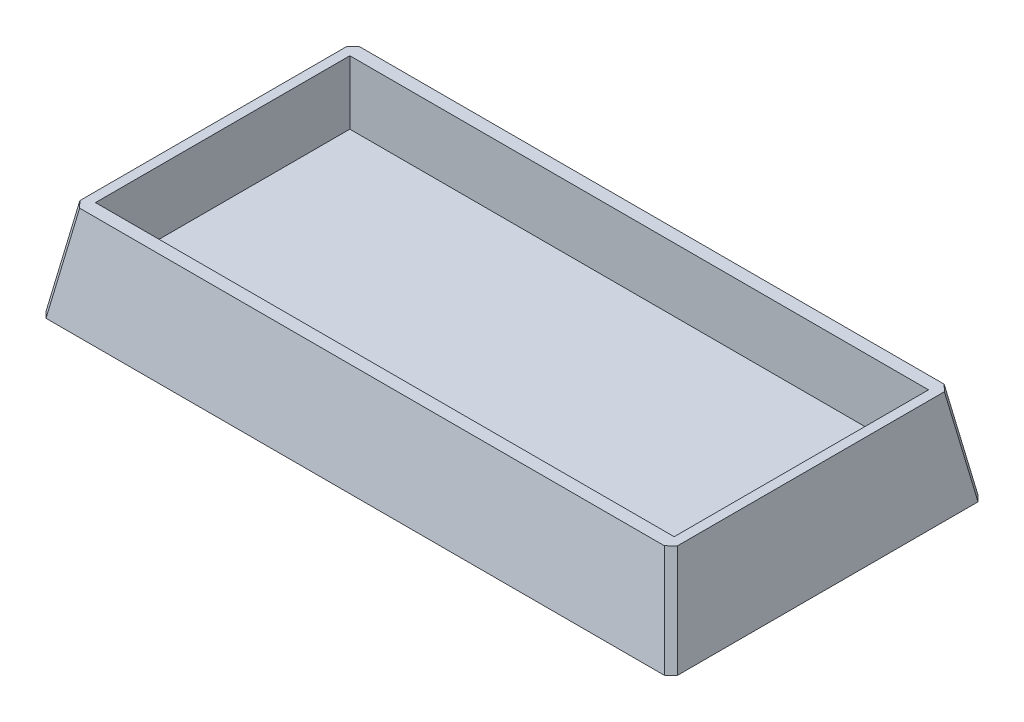
from build123d import *
from OCP.BRepFilletAPI import BRepFilletAPI_MakeChamfer

# Parameters (mm, degrees)
SKETCH2_W           = 100
SKETCH2_H           = 50
SKETCH2_W_2         = 91
SKETCH2_H_2         = 40
BOSS_EXTRUDE1_DEPTH = 10
SKETCH3_W           = 100
SKETCH3_H           = 50
BOSS_EXTRUDE2_DEPTH = 5
CHAMFER1_SIZE       = 17
CHAMFER1_SIZE_2     = 2.997558672
CHAMFER2_SIZE       = 1
CHAMFER2_SIZE2      = 1.031574872


with BuildPart() as part:
    # Sketch2 → Boss-Extrude1 (new body)
    with BuildSketch(Plane(origin=(0, 0, 0), x_dir=(1, 0, 0), z_dir=(0, 1, 0))):
        Rectangle(SKETCH2_W, SKETCH2_H)
        Rectangle(SKETCH2_W_2, SKETCH2_H_2, mode=Mode.SUBTRACT)
    extrude(amount=BOSS_EXTRUDE1_DEPTH)

    # Sketch3 → Boss-Extrude2 (add)
    with BuildSketch(Plane.XZ):
        Rectangle(SKETCH3_W, SKETCH3_H)
    extrude(amount=BOSS_EXTRUDE2_DEPTH)

    # Chamfer1
    # the kernel refuses this chamfer: 17, 2.997558672 mm, written as the material it takes off along each edge
    with BuildSketch(Plane(origin=(-50, 10, 69.175159539), x_dir=(-0.0066825316561016975, -0.9999776716360548, 0), z_dir=(0, 0, -1)), Plane(origin=(50, 10, -69.175159539), x_dir=(0.0066825316561016975, -0.9999776716360548, 0), z_dir=(0, 0, 1))) as chamfer1_piece_1:
        Polygon((CHAMFER1_SIZE * 0.999977671636, -CHAMFER1_SIZE * 0.0066825316561), (-CHAMFER1_SIZE_2 * 0.0066825316562, -CHAMFER1_SIZE_2 * 0.999977671651), (0, 0), align=None)
    extrude(amount=138.350319078, mode=Mode.SUBTRACT)
    with BuildSketch(Plane(origin=(-94.175159539, 10, -25), x_dir=(0, -0.9999776716360548, -0.0066825316561016975), z_dir=(1, 0, 0)), Plane(origin=(94.175159539, 10, 25), x_dir=(0, -0.9999776716360548, 0.0066825316561016975), z_dir=(-1, 0, 0))) as chamfer1_piece_2:
        Polygon((CHAMFER1_SIZE * 0.999977671636, -CHAMFER1_SIZE * 0.0066825316561), (-CHAMFER1_SIZE_2 * 0.0066825316562, -CHAMFER1_SIZE_2 * 0.999977671651), (0, 0), align=None)
    extrude(amount=188.350319078, mode=Mode.SUBTRACT)

    # Chamfer2: one chamfer whose edges measure the first distance from different faces: ONE call of the kernel's chamfer builder (chamfer() names one face for all edges)
    chamfer2_edges_1 = [part.edges().sort_by_distance(p)[0] for p in [
        (48.324893683, 2.5, -23.324893683),
        (48.324893683, 2.5, 23.324893683),
    ]]
    chamfer2_side_1 = [part.faces().sort_by_distance(p)[0] for p in [
        (48.349886727, 2.358257408, 0),
    ]]
    chamfer2_edges_2 = [part.edges().sort_by_distance(p)[0] for p in [
        (-48.324893683, 2.5, -23.324893683),
    ]]
    chamfer2_side_2 = [part.faces().sort_by_distance(p)[0] for p in [
        (0, 2.431585346, -23.336957033),
    ]]
    chamfer2_edges_3 = [part.edges().sort_by_distance(p)[0] for p in [
        (-48.324893683, 2.5, 23.324893683),
    ]]
    chamfer2_side_3 = [part.faces().sort_by_distance(p)[0] for p in [
        (0, 2.431585346, 23.336957033),
    ]]
    chamfer2 = BRepFilletAPI_MakeChamfer(part.part.solid().wrapped)
    for e in chamfer2_edges_1:
        chamfer2.Add(CHAMFER2_SIZE, CHAMFER2_SIZE2, e.wrapped, chamfer2_side_1[0].wrapped)  # the first distance lies on this face
    for e in chamfer2_edges_2:
        chamfer2.Add(CHAMFER2_SIZE, CHAMFER2_SIZE2, e.wrapped, chamfer2_side_2[0].wrapped)  # the first distance lies on this face
    for e in chamfer2_edges_3:
        chamfer2.Add(CHAMFER2_SIZE, CHAMFER2_SIZE2, e.wrapped, chamfer2_side_3[0].wrapped)  # the first distance lies on this face
    add(Compound.cast(chamfer2.Shape()), mode=Mode.REPLACE)


solid = part.part
